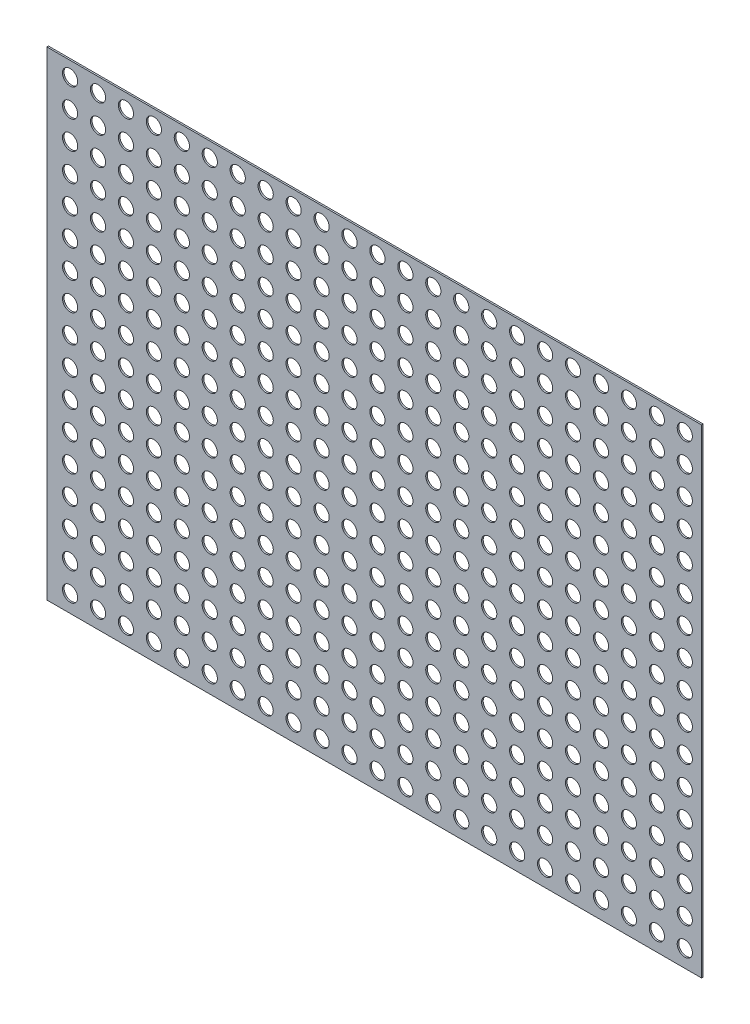
from build123d import *

# Parameters (mm, degrees)
SKETCH1_W           = 820
SKETCH1_H           = 600
BOSS_EXTRUDE1_DEPTH = 2
SKETCH2_R           = 9.524283463
CUT_EXTRUDE2_DEPTH  = 2
LPATTERN1_OUTLINE_R = 9.524283463
LPATTERN1_DEPTH     = 2


# Read off the part's stored shape, not the designer's step: LPattern1
with BuildPart() as part:
    # Sketch1 → Boss-Extrude1 (new body)
    with BuildSketch(Plane.XY):
        Rectangle(SKETCH1_W, SKETCH1_H)
    extrude(amount=BOSS_EXTRUDE1_DEPTH)

    # Sketch2 → Cut-Extrude2 (cut)
    with BuildSketch(Plane.XY):
        with Locations((-380.950405278, 281.61650156)):
            Circle(SKETCH2_R)
    extrude(amount=CUT_EXTRUDE2_DEPTH, mode=Mode.SUBTRACT)

    # LPattern1 outline → LPattern1 (cut)
    with BuildSketch(Plane.XY):
        with Locations((389.049594722, -278.38349844)):
            Circle(LPATTERN1_OUTLINE_R)
        with Locations((354.049594722, -278.38349844)):
            Circle(LPATTERN1_OUTLINE_R)
        with Locations((319.049594722, -278.38349844)):
            Circle(LPATTERN1_OUTLINE_R)
        with Locations((284.049594722, -278.38349844)):
            Circle(LPATTERN1_OUTLINE_R)
        with Locations((249.049594722, -278.38349844)):
            Circle(LPATTERN1_OUTLINE_R)
        with Locations((214.049594722, -278.38349844)):
            Circle(LPATTERN1_OUTLINE_R)
        with Locations((179.049594722, -278.38349844)):
            Circle(LPATTERN1_OUTLINE_R)
        with Locations((144.049594722, -278.38349844)):
            Circle(LPATTERN1_OUTLINE_R)
        with Locations((109.049594722, -278.38349844)):
            Circle(LPATTERN1_OUTLINE_R)
        with Locations((74.049594722, -278.38349844)):
            Circle(LPATTERN1_OUTLINE_R)
        with Locations((39.049594722, -278.38349844)):
            Circle(LPATTERN1_OUTLINE_R)
        with Locations((4.049594722, -278.38349844)):
            Circle(LPATTERN1_OUTLINE_R)
        with Locations((-30.950405278, -278.38349844)):
            Circle(LPATTERN1_OUTLINE_R)
        with Locations((-65.950405278, -278.38349844)):
            Circle(LPATTERN1_OUTLINE_R)
        with Locations((-100.950405278, -278.38349844)):
            Circle(LPATTERN1_OUTLINE_R)
        with Locations((-135.950405278, -278.38349844)):
            Circle(LPATTERN1_OUTLINE_R)
        with Locations((-170.950405278, -278.38349844)):
            Circle(LPATTERN1_OUTLINE_R)
        with Locations((-205.950405278, -278.38349844)):
            Circle(LPATTERN1_OUTLINE_R)
        with Locations((-240.950405278, -278.38349844)):
            Circle(LPATTERN1_OUTLINE_R)
        with Locations((-275.950405278, -278.38349844)):
            Circle(LPATTERN1_OUTLINE_R)
        with Locations((-310.950405278, -278.38349844)):
            Circle(LPATTERN1_OUTLINE_R)
        with Locations((-345.950405278, -278.38349844)):
            Circle(LPATTERN1_OUTLINE_R)
        with Locations((-380.950405278, -278.38349844)):
            Circle(LPATTERN1_OUTLINE_R)
        with Locations((389.049594722, -243.38349844)):
            Circle(LPATTERN1_OUTLINE_R)
        with Locations((354.049594722, -243.38349844)):
            Circle(LPATTERN1_OUTLINE_R)
        with Locations((319.049594722, -243.38349844)):
            Circle(LPATTERN1_OUTLINE_R)
        with Locations((284.049594722, -243.38349844)):
            Circle(LPATTERN1_OUTLINE_R)
        with Locations((249.049594722, -243.38349844)):
            Circle(LPATTERN1_OUTLINE_R)
        with Locations((214.049594722, -243.38349844)):
            Circle(LPATTERN1_OUTLINE_R)
        with Locations((179.049594722, -243.38349844)):
            Circle(LPATTERN1_OUTLINE_R)
        with Locations((144.049594722, -243.38349844)):
            Circle(LPATTERN1_OUTLINE_R)
        with Locations((109.049594722, -243.38349844)):
            Circle(LPATTERN1_OUTLINE_R)
        with Locations((74.049594722, -243.38349844)):
            Circle(LPATTERN1_OUTLINE_R)
        with Locations((39.049594722, -243.38349844)):
            Circle(LPATTERN1_OUTLINE_R)
        with Locations((4.049594722, -243.38349844)):
            Circle(LPATTERN1_OUTLINE_R)
        with Locations((-30.950405278, -243.38349844)):
            Circle(LPATTERN1_OUTLINE_R)
        with Locations((-65.950405278, -243.38349844)):
            Circle(LPATTERN1_OUTLINE_R)
        with Locations((-100.950405278, -243.38349844)):
            Circle(LPATTERN1_OUTLINE_R)
        with Locations((-135.950405278, -243.38349844)):
            Circle(LPATTERN1_OUTLINE_R)
        with Locations((-170.950405278, -243.38349844)):
            Circle(LPATTERN1_OUTLINE_R)
        with Locations((-205.950405278, -243.38349844)):
            Circle(LPATTERN1_OUTLINE_R)
        with Locations((-240.950405278, -243.38349844)):
            Circle(LPATTERN1_OUTLINE_R)
        with Locations((-275.950405278, -243.38349844)):
            Circle(LPATTERN1_OUTLINE_R)
        with Locations((-310.950405278, -243.38349844)):
            Circle(LPATTERN1_OUTLINE_R)
        with Locations((-345.950405278, -243.38349844)):
            Circle(LPATTERN1_OUTLINE_R)
        with Locations((-380.950405278, -243.38349844)):
            Circle(LPATTERN1_OUTLINE_R)
        with Locations((389.049594722, -208.38349844)):
            Circle(LPATTERN1_OUTLINE_R)
        with Locations((354.049594722, -208.38349844)):
            Circle(LPATTERN1_OUTLINE_R)
        with Locations((319.049594722, -208.38349844)):
            Circle(LPATTERN1_OUTLINE_R)
        with Locations((284.049594722, -208.38349844)):
            Circle(LPATTERN1_OUTLINE_R)
        with Locations((249.049594722, -208.38349844)):
            Circle(LPATTERN1_OUTLINE_R)
        with Locations((214.049594722, -208.38349844)):
            Circle(LPATTERN1_OUTLINE_R)
        with Locations((179.049594722, -208.38349844)):
            Circle(LPATTERN1_OUTLINE_R)
        with Locations((144.049594722, -208.38349844)):
            Circle(LPATTERN1_OUTLINE_R)
        with Locations((109.049594722, -208.38349844)):
            Circle(LPATTERN1_OUTLINE_R)
        with Locations((74.049594722, -208.38349844)):
            Circle(LPATTERN1_OUTLINE_R)
        with Locations((39.049594722, -208.38349844)):
            Circle(LPATTERN1_OUTLINE_R)
        with Locations((4.049594722, -208.38349844)):
            Circle(LPATTERN1_OUTLINE_R)
        with Locations((-30.950405278, -208.38349844)):
            Circle(LPATTERN1_OUTLINE_R)
        with Locations((-65.950405278, -208.38349844)):
            Circle(LPATTERN1_OUTLINE_R)
        with Locations((-100.950405278, -208.38349844)):
            Circle(LPATTERN1_OUTLINE_R)
        with Locations((-135.950405278, -208.38349844)):
            Circle(LPATTERN1_OUTLINE_R)
        with Locations((-170.950405278, -208.38349844)):
            Circle(LPATTERN1_OUTLINE_R)
        with Locations((-205.950405278, -208.38349844)):
            Circle(LPATTERN1_OUTLINE_R)
        with Locations((-240.950405278, -208.38349844)):
            Circle(LPATTERN1_OUTLINE_R)
        with Locations((-275.950405278, -208.38349844)):
            Circle(LPATTERN1_OUTLINE_R)
        with Locations((-310.950405278, -208.38349844)):
            Circle(LPATTERN1_OUTLINE_R)
        with Locations((-345.950405278, -208.38349844)):
            Circle(LPATTERN1_OUTLINE_R)
        with Locations((-380.950405278, -208.38349844)):
            Circle(LPATTERN1_OUTLINE_R)
        with Locations((389.049594722, -173.38349844)):
            Circle(LPATTERN1_OUTLINE_R)
        with Locations((354.049594722, -173.38349844)):
            Circle(LPATTERN1_OUTLINE_R)
        with Locations((319.049594722, -173.38349844)):
            Circle(LPATTERN1_OUTLINE_R)
        with Locations((284.049594722, -173.38349844)):
            Circle(LPATTERN1_OUTLINE_R)
        with Locations((249.049594722, -173.38349844)):
            Circle(LPATTERN1_OUTLINE_R)
        with Locations((214.049594722, -173.38349844)):
            Circle(LPATTERN1_OUTLINE_R)
        with Locations((179.049594722, -173.38349844)):
            Circle(LPATTERN1_OUTLINE_R)
        with Locations((144.049594722, -173.38349844)):
            Circle(LPATTERN1_OUTLINE_R)
        with Locations((109.049594722, -173.38349844)):
            Circle(LPATTERN1_OUTLINE_R)
        with Locations((74.049594722, -173.38349844)):
            Circle(LPATTERN1_OUTLINE_R)
        with Locations((39.049594722, -173.38349844)):
            Circle(LPATTERN1_OUTLINE_R)
        with Locations((4.049594722, -173.38349844)):
            Circle(LPATTERN1_OUTLINE_R)
        with Locations((-30.950405278, -173.38349844)):
            Circle(LPATTERN1_OUTLINE_R)
        with Locations((-65.950405278, -173.38349844)):
            Circle(LPATTERN1_OUTLINE_R)
        with Locations((-100.950405278, -173.38349844)):
            Circle(LPATTERN1_OUTLINE_R)
        with Locations((-135.950405278, -173.38349844)):
            Circle(LPATTERN1_OUTLINE_R)
        with Locations((-170.950405278, -173.38349844)):
            Circle(LPATTERN1_OUTLINE_R)
        with Locations((-205.950405278, -173.38349844)):
            Circle(LPATTERN1_OUTLINE_R)
        with Locations((-240.950405278, -173.38349844)):
            Circle(LPATTERN1_OUTLINE_R)
        with Locations((-275.950405278, -173.38349844)):
            Circle(LPATTERN1_OUTLINE_R)
        with Locations((-310.950405278, -173.38349844)):
            Circle(LPATTERN1_OUTLINE_R)
        with Locations((-345.950405278, -173.38349844)):
            Circle(LPATTERN1_OUTLINE_R)
        with Locations((-380.950405278, -173.38349844)):
            Circle(LPATTERN1_OUTLINE_R)
        with Locations((389.049594722, -138.38349844)):
            Circle(LPATTERN1_OUTLINE_R)
        with Locations((354.049594722, -138.38349844)):
            Circle(LPATTERN1_OUTLINE_R)
        with Locations((319.049594722, -138.38349844)):
            Circle(LPATTERN1_OUTLINE_R)
        with Locations((284.049594722, -138.38349844)):
            Circle(LPATTERN1_OUTLINE_R)
        with Locations((249.049594722, -138.38349844)):
            Circle(LPATTERN1_OUTLINE_R)
        with Locations((214.049594722, -138.38349844)):
            Circle(LPATTERN1_OUTLINE_R)
        with Locations((179.049594722, -138.38349844)):
            Circle(LPATTERN1_OUTLINE_R)
        with Locations((144.049594722, -138.38349844)):
            Circle(LPATTERN1_OUTLINE_R)
        with Locations((109.049594722, -138.38349844)):
            Circle(LPATTERN1_OUTLINE_R)
        with Locations((74.049594722, -138.38349844)):
            Circle(LPATTERN1_OUTLINE_R)
        with Locations((39.049594722, -138.38349844)):
            Circle(LPATTERN1_OUTLINE_R)
        with Locations((4.049594722, -138.38349844)):
            Circle(LPATTERN1_OUTLINE_R)
        with Locations((-30.950405278, -138.38349844)):
            Circle(LPATTERN1_OUTLINE_R)
        with Locations((-65.950405278, -138.38349844)):
            Circle(LPATTERN1_OUTLINE_R)
        with Locations((-100.950405278, -138.38349844)):
            Circle(LPATTERN1_OUTLINE_R)
        with Locations((-135.950405278, -138.38349844)):
            Circle(LPATTERN1_OUTLINE_R)
        with Locations((-170.950405278, -138.38349844)):
            Circle(LPATTERN1_OUTLINE_R)
        with Locations((-205.950405278, -138.38349844)):
            Circle(LPATTERN1_OUTLINE_R)
        with Locations((-240.950405278, -138.38349844)):
            Circle(LPATTERN1_OUTLINE_R)
        with Locations((-275.950405278, -138.38349844)):
            Circle(LPATTERN1_OUTLINE_R)
        with Locations((-310.950405278, -138.38349844)):
            Circle(LPATTERN1_OUTLINE_R)
        with Locations((-345.950405278, -138.38349844)):
            Circle(LPATTERN1_OUTLINE_R)
        with Locations((-380.950405278, -138.38349844)):
            Circle(LPATTERN1_OUTLINE_R)
        with Locations((389.049594722, -103.38349844)):
            Circle(LPATTERN1_OUTLINE_R)
        with Locations((354.049594722, -103.38349844)):
            Circle(LPATTERN1_OUTLINE_R)
        with Locations((319.049594722, -103.38349844)):
            Circle(LPATTERN1_OUTLINE_R)
        with Locations((284.049594722, -103.38349844)):
            Circle(LPATTERN1_OUTLINE_R)
        with Locations((249.049594722, -103.38349844)):
            Circle(LPATTERN1_OUTLINE_R)
        with Locations((214.049594722, -103.38349844)):
            Circle(LPATTERN1_OUTLINE_R)
        with Locations((179.049594722, -103.38349844)):
            Circle(LPATTERN1_OUTLINE_R)
        with Locations((144.049594722, -103.38349844)):
            Circle(LPATTERN1_OUTLINE_R)
        with Locations((109.049594722, -103.38349844)):
            Circle(LPATTERN1_OUTLINE_R)
        with Locations((74.049594722, -103.38349844)):
            Circle(LPATTERN1_OUTLINE_R)
        with Locations((39.049594722, -103.38349844)):
            Circle(LPATTERN1_OUTLINE_R)
        with Locations((4.049594722, -103.38349844)):
            Circle(LPATTERN1_OUTLINE_R)
        with Locations((-30.950405278, -103.38349844)):
            Circle(LPATTERN1_OUTLINE_R)
        with Locations((-65.950405278, -103.38349844)):
            Circle(LPATTERN1_OUTLINE_R)
        with Locations((-100.950405278, -103.38349844)):
            Circle(LPATTERN1_OUTLINE_R)
        with Locations((-135.950405278, -103.38349844)):
            Circle(LPATTERN1_OUTLINE_R)
        with Locations((-170.950405278, -103.38349844)):
            Circle(LPATTERN1_OUTLINE_R)
        with Locations((-205.950405278, -103.38349844)):
            Circle(LPATTERN1_OUTLINE_R)
        with Locations((-240.950405278, -103.38349844)):
            Circle(LPATTERN1_OUTLINE_R)
        with Locations((-275.950405278, -103.38349844)):
            Circle(LPATTERN1_OUTLINE_R)
        with Locations((-310.950405278, -103.38349844)):
            Circle(LPATTERN1_OUTLINE_R)
        with Locations((-345.950405278, -103.38349844)):
            Circle(LPATTERN1_OUTLINE_R)
        with Locations((-380.950405278, -103.38349844)):
            Circle(LPATTERN1_OUTLINE_R)
        with Locations((389.049594722, -68.38349844)):
            Circle(LPATTERN1_OUTLINE_R)
        with Locations((354.049594722, -68.38349844)):
            Circle(LPATTERN1_OUTLINE_R)
        with Locations((319.049594722, -68.38349844)):
            Circle(LPATTERN1_OUTLINE_R)
        with Locations((284.049594722, -68.38349844)):
            Circle(LPATTERN1_OUTLINE_R)
        with Locations((249.049594722, -68.38349844)):
            Circle(LPATTERN1_OUTLINE_R)
        with Locations((214.049594722, -68.38349844)):
            Circle(LPATTERN1_OUTLINE_R)
        with Locations((179.049594722, -68.38349844)):
            Circle(LPATTERN1_OUTLINE_R)
        with Locations((144.049594722, -68.38349844)):
            Circle(LPATTERN1_OUTLINE_R)
        with Locations((109.049594722, -68.38349844)):
            Circle(LPATTERN1_OUTLINE_R)
        with Locations((74.049594722, -68.38349844)):
            Circle(LPATTERN1_OUTLINE_R)
        with Locations((39.049594722, -68.38349844)):
            Circle(LPATTERN1_OUTLINE_R)
        with Locations((4.049594722, -68.38349844)):
            Circle(LPATTERN1_OUTLINE_R)
        with Locations((-30.950405278, -68.38349844)):
            Circle(LPATTERN1_OUTLINE_R)
        with Locations((-65.950405278, -68.38349844)):
            Circle(LPATTERN1_OUTLINE_R)
        with Locations((-100.950405278, -68.38349844)):
            Circle(LPATTERN1_OUTLINE_R)
        with Locations((-135.950405278, -68.38349844)):
            Circle(LPATTERN1_OUTLINE_R)
        with Locations((-170.950405278, -68.38349844)):
            Circle(LPATTERN1_OUTLINE_R)
        with Locations((-205.950405278, -68.38349844)):
            Circle(LPATTERN1_OUTLINE_R)
        with Locations((-240.950405278, -68.38349844)):
            Circle(LPATTERN1_OUTLINE_R)
        with Locations((-275.950405278, -68.38349844)):
            Circle(LPATTERN1_OUTLINE_R)
        with Locations((-310.950405278, -68.38349844)):
            Circle(LPATTERN1_OUTLINE_R)
        with Locations((-345.950405278, -68.38349844)):
            Circle(LPATTERN1_OUTLINE_R)
        with Locations((-380.950405278, -68.38349844)):
            Circle(LPATTERN1_OUTLINE_R)
        with Locations((389.049594722, -33.38349844)):
            Circle(LPATTERN1_OUTLINE_R)
        with Locations((354.049594722, -33.38349844)):
            Circle(LPATTERN1_OUTLINE_R)
        with Locations((319.049594722, -33.38349844)):
            Circle(LPATTERN1_OUTLINE_R)
        with Locations((284.049594722, -33.38349844)):
            Circle(LPATTERN1_OUTLINE_R)
        with Locations((249.049594722, -33.38349844)):
            Circle(LPATTERN1_OUTLINE_R)
        with Locations((214.049594722, -33.38349844)):
            Circle(LPATTERN1_OUTLINE_R)
        with Locations((179.049594722, -33.38349844)):
            Circle(LPATTERN1_OUTLINE_R)
        with Locations((144.049594722, -33.38349844)):
            Circle(LPATTERN1_OUTLINE_R)
        with Locations((109.049594722, -33.38349844)):
            Circle(LPATTERN1_OUTLINE_R)
        with Locations((74.049594722, -33.38349844)):
            Circle(LPATTERN1_OUTLINE_R)
        with Locations((39.049594722, -33.38349844)):
            Circle(LPATTERN1_OUTLINE_R)
        with Locations((4.049594722, -33.38349844)):
            Circle(LPATTERN1_OUTLINE_R)
        with Locations((-30.950405278, -33.38349844)):
            Circle(LPATTERN1_OUTLINE_R)
        with Locations((-65.950405278, -33.38349844)):
            Circle(LPATTERN1_OUTLINE_R)
        with Locations((-100.950405278, -33.38349844)):
            Circle(LPATTERN1_OUTLINE_R)
        with Locations((-135.950405278, -33.38349844)):
            Circle(LPATTERN1_OUTLINE_R)
        with Locations((-170.950405278, -33.38349844)):
            Circle(LPATTERN1_OUTLINE_R)
        with Locations((-205.950405278, -33.38349844)):
            Circle(LPATTERN1_OUTLINE_R)
        with Locations((-240.950405278, -33.38349844)):
            Circle(LPATTERN1_OUTLINE_R)
        with Locations((-275.950405278, -33.38349844)):
            Circle(LPATTERN1_OUTLINE_R)
        with Locations((-310.950405278, -33.38349844)):
            Circle(LPATTERN1_OUTLINE_R)
        with Locations((-345.950405278, -33.38349844)):
            Circle(LPATTERN1_OUTLINE_R)
        with Locations((-380.950405278, -33.38349844)):
            Circle(LPATTERN1_OUTLINE_R)
        with Locations((389.049594722, 1.61650156)):
            Circle(LPATTERN1_OUTLINE_R)
        with Locations((354.049594722, 1.61650156)):
            Circle(LPATTERN1_OUTLINE_R)
        with Locations((319.049594722, 1.61650156)):
            Circle(LPATTERN1_OUTLINE_R)
        with Locations((284.049594722, 1.61650156)):
            Circle(LPATTERN1_OUTLINE_R)
        with Locations((249.049594722, 1.61650156)):
            Circle(LPATTERN1_OUTLINE_R)
        with Locations((214.049594722, 1.61650156)):
            Circle(LPATTERN1_OUTLINE_R)
        with Locations((179.049594722, 1.61650156)):
            Circle(LPATTERN1_OUTLINE_R)
        with Locations((144.049594722, 1.61650156)):
            Circle(LPATTERN1_OUTLINE_R)
        with Locations((109.049594722, 1.61650156)):
            Circle(LPATTERN1_OUTLINE_R)
        with Locations((74.049594722, 1.61650156)):
            Circle(LPATTERN1_OUTLINE_R)
        with Locations((39.049594722, 1.61650156)):
            Circle(LPATTERN1_OUTLINE_R)
        with Locations((4.049594722, 1.61650156)):
            Circle(LPATTERN1_OUTLINE_R)
        with Locations((-30.950405278, 1.61650156)):
            Circle(LPATTERN1_OUTLINE_R)
        with Locations((-65.950405278, 1.61650156)):
            Circle(LPATTERN1_OUTLINE_R)
        with Locations((-100.950405278, 1.61650156)):
            Circle(LPATTERN1_OUTLINE_R)
        with Locations((-135.950405278, 1.61650156)):
            Circle(LPATTERN1_OUTLINE_R)
        with Locations((-170.950405278, 1.61650156)):
            Circle(LPATTERN1_OUTLINE_R)
        with Locations((-205.950405278, 1.61650156)):
            Circle(LPATTERN1_OUTLINE_R)
        with Locations((-240.950405278, 1.61650156)):
            Circle(LPATTERN1_OUTLINE_R)
        with Locations((-275.950405278, 1.61650156)):
            Circle(LPATTERN1_OUTLINE_R)
        with Locations((-310.950405278, 1.61650156)):
            Circle(LPATTERN1_OUTLINE_R)
        with Locations((-345.950405278, 1.61650156)):
            Circle(LPATTERN1_OUTLINE_R)
        with Locations((-380.950405278, 1.61650156)):
            Circle(LPATTERN1_OUTLINE_R)
        with Locations((389.049594722, 36.61650156)):
            Circle(LPATTERN1_OUTLINE_R)
        with Locations((354.049594722, 36.61650156)):
            Circle(LPATTERN1_OUTLINE_R)
        with Locations((319.049594722, 36.61650156)):
            Circle(LPATTERN1_OUTLINE_R)
        with Locations((284.049594722, 36.61650156)):
            Circle(LPATTERN1_OUTLINE_R)
        with Locations((249.049594722, 36.61650156)):
            Circle(LPATTERN1_OUTLINE_R)
        with Locations((214.049594722, 36.61650156)):
            Circle(LPATTERN1_OUTLINE_R)
        with Locations((179.049594722, 36.61650156)):
            Circle(LPATTERN1_OUTLINE_R)
        with Locations((144.049594722, 36.61650156)):
            Circle(LPATTERN1_OUTLINE_R)
        with Locations((109.049594722, 36.61650156)):
            Circle(LPATTERN1_OUTLINE_R)
        with Locations((74.049594722, 36.61650156)):
            Circle(LPATTERN1_OUTLINE_R)
        with Locations((39.049594722, 36.61650156)):
            Circle(LPATTERN1_OUTLINE_R)
        with Locations((4.049594722, 36.61650156)):
            Circle(LPATTERN1_OUTLINE_R)
        with Locations((-30.950405278, 36.61650156)):
            Circle(LPATTERN1_OUTLINE_R)
        with Locations((-65.950405278, 36.61650156)):
            Circle(LPATTERN1_OUTLINE_R)
        with Locations((-100.950405278, 36.61650156)):
            Circle(LPATTERN1_OUTLINE_R)
        with Locations((-135.950405278, 36.61650156)):
            Circle(LPATTERN1_OUTLINE_R)
        with Locations((-170.950405278, 36.61650156)):
            Circle(LPATTERN1_OUTLINE_R)
        with Locations((-205.950405278, 36.61650156)):
            Circle(LPATTERN1_OUTLINE_R)
        with Locations((-240.950405278, 36.61650156)):
            Circle(LPATTERN1_OUTLINE_R)
        with Locations((-275.950405278, 36.61650156)):
            Circle(LPATTERN1_OUTLINE_R)
        with Locations((-310.950405278, 36.61650156)):
            Circle(LPATTERN1_OUTLINE_R)
        with Locations((-345.950405278, 36.61650156)):
            Circle(LPATTERN1_OUTLINE_R)
        with Locations((-380.950405278, 36.61650156)):
            Circle(LPATTERN1_OUTLINE_R)
        with Locations((389.049594722, 71.61650156)):
            Circle(LPATTERN1_OUTLINE_R)
        with Locations((354.049594722, 71.61650156)):
            Circle(LPATTERN1_OUTLINE_R)
        with Locations((319.049594722, 71.61650156)):
            Circle(LPATTERN1_OUTLINE_R)
        with Locations((284.049594722, 71.61650156)):
            Circle(LPATTERN1_OUTLINE_R)
        with Locations((249.049594722, 71.61650156)):
            Circle(LPATTERN1_OUTLINE_R)
        with Locations((214.049594722, 71.61650156)):
            Circle(LPATTERN1_OUTLINE_R)
        with Locations((179.049594722, 71.61650156)):
            Circle(LPATTERN1_OUTLINE_R)
        with Locations((144.049594722, 71.61650156)):
            Circle(LPATTERN1_OUTLINE_R)
        with Locations((109.049594722, 71.61650156)):
            Circle(LPATTERN1_OUTLINE_R)
        with Locations((74.049594722, 71.61650156)):
            Circle(LPATTERN1_OUTLINE_R)
        with Locations((39.049594722, 71.61650156)):
            Circle(LPATTERN1_OUTLINE_R)
        with Locations((4.049594722, 71.61650156)):
            Circle(LPATTERN1_OUTLINE_R)
        with Locations((-30.950405278, 71.61650156)):
            Circle(LPATTERN1_OUTLINE_R)
        with Locations((-65.950405278, 71.61650156)):
            Circle(LPATTERN1_OUTLINE_R)
        with Locations((-100.950405278, 71.61650156)):
            Circle(LPATTERN1_OUTLINE_R)
        with Locations((-135.950405278, 71.61650156)):
            Circle(LPATTERN1_OUTLINE_R)
        with Locations((-170.950405278, 71.61650156)):
            Circle(LPATTERN1_OUTLINE_R)
        with Locations((-205.950405278, 71.61650156)):
            Circle(LPATTERN1_OUTLINE_R)
        with Locations((-240.950405278, 71.61650156)):
            Circle(LPATTERN1_OUTLINE_R)
        with Locations((-275.950405278, 71.61650156)):
            Circle(LPATTERN1_OUTLINE_R)
        with Locations((-310.950405278, 71.61650156)):
            Circle(LPATTERN1_OUTLINE_R)
        with Locations((-345.950405278, 71.61650156)):
            Circle(LPATTERN1_OUTLINE_R)
        with Locations((-380.950405278, 71.61650156)):
            Circle(LPATTERN1_OUTLINE_R)
        with Locations((389.049594722, 106.61650156)):
            Circle(LPATTERN1_OUTLINE_R)
        with Locations((354.049594722, 106.61650156)):
            Circle(LPATTERN1_OUTLINE_R)
        with Locations((319.049594722, 106.61650156)):
            Circle(LPATTERN1_OUTLINE_R)
        with Locations((284.049594722, 106.61650156)):
            Circle(LPATTERN1_OUTLINE_R)
        with Locations((249.049594722, 106.61650156)):
            Circle(LPATTERN1_OUTLINE_R)
        with Locations((214.049594722, 106.61650156)):
            Circle(LPATTERN1_OUTLINE_R)
        with Locations((179.049594722, 106.61650156)):
            Circle(LPATTERN1_OUTLINE_R)
        with Locations((144.049594722, 106.61650156)):
            Circle(LPATTERN1_OUTLINE_R)
        with Locations((109.049594722, 106.61650156)):
            Circle(LPATTERN1_OUTLINE_R)
        with Locations((74.049594722, 106.61650156)):
            Circle(LPATTERN1_OUTLINE_R)
        with Locations((39.049594722, 106.61650156)):
            Circle(LPATTERN1_OUTLINE_R)
        with Locations((4.049594722, 106.61650156)):
            Circle(LPATTERN1_OUTLINE_R)
        with Locations((-30.950405278, 106.61650156)):
            Circle(LPATTERN1_OUTLINE_R)
        with Locations((-65.950405278, 106.61650156)):
            Circle(LPATTERN1_OUTLINE_R)
        with Locations((-100.950405278, 106.61650156)):
            Circle(LPATTERN1_OUTLINE_R)
        with Locations((-135.950405278, 106.61650156)):
            Circle(LPATTERN1_OUTLINE_R)
        with Locations((-170.950405278, 106.61650156)):
            Circle(LPATTERN1_OUTLINE_R)
        with Locations((-205.950405278, 106.61650156)):
            Circle(LPATTERN1_OUTLINE_R)
        with Locations((-240.950405278, 106.61650156)):
            Circle(LPATTERN1_OUTLINE_R)
        with Locations((-275.950405278, 106.61650156)):
            Circle(LPATTERN1_OUTLINE_R)
        with Locations((-310.950405278, 106.61650156)):
            Circle(LPATTERN1_OUTLINE_R)
        with Locations((-345.950405278, 106.61650156)):
            Circle(LPATTERN1_OUTLINE_R)
        with Locations((-380.950405278, 106.61650156)):
            Circle(LPATTERN1_OUTLINE_R)
        with Locations((389.049594722, 141.61650156)):
            Circle(LPATTERN1_OUTLINE_R)
        with Locations((354.049594722, 141.61650156)):
            Circle(LPATTERN1_OUTLINE_R)
        with Locations((319.049594722, 141.61650156)):
            Circle(LPATTERN1_OUTLINE_R)
        with Locations((284.049594722, 141.61650156)):
            Circle(LPATTERN1_OUTLINE_R)
        with Locations((249.049594722, 141.61650156)):
            Circle(LPATTERN1_OUTLINE_R)
        with Locations((214.049594722, 141.61650156)):
            Circle(LPATTERN1_OUTLINE_R)
        with Locations((179.049594722, 141.61650156)):
            Circle(LPATTERN1_OUTLINE_R)
        with Locations((144.049594722, 141.61650156)):
            Circle(LPATTERN1_OUTLINE_R)
        with Locations((109.049594722, 141.61650156)):
            Circle(LPATTERN1_OUTLINE_R)
        with Locations((74.049594722, 141.61650156)):
            Circle(LPATTERN1_OUTLINE_R)
        with Locations((39.049594722, 141.61650156)):
            Circle(LPATTERN1_OUTLINE_R)
        with Locations((4.049594722, 141.61650156)):
            Circle(LPATTERN1_OUTLINE_R)
        with Locations((-30.950405278, 141.61650156)):
            Circle(LPATTERN1_OUTLINE_R)
        with Locations((-65.950405278, 141.61650156)):
            Circle(LPATTERN1_OUTLINE_R)
        with Locations((-100.950405278, 141.61650156)):
            Circle(LPATTERN1_OUTLINE_R)
        with Locations((-135.950405278, 141.61650156)):
            Circle(LPATTERN1_OUTLINE_R)
        with Locations((-170.950405278, 141.61650156)):
            Circle(LPATTERN1_OUTLINE_R)
        with Locations((-205.950405278, 141.61650156)):
            Circle(LPATTERN1_OUTLINE_R)
        with Locations((-240.950405278, 141.61650156)):
            Circle(LPATTERN1_OUTLINE_R)
        with Locations((-275.950405278, 141.61650156)):
            Circle(LPATTERN1_OUTLINE_R)
        with Locations((-310.950405278, 141.61650156)):
            Circle(LPATTERN1_OUTLINE_R)
        with Locations((-345.950405278, 141.61650156)):
            Circle(LPATTERN1_OUTLINE_R)
        with Locations((-380.950405278, 141.61650156)):
            Circle(LPATTERN1_OUTLINE_R)
        with Locations((389.049594722, 176.61650156)):
            Circle(LPATTERN1_OUTLINE_R)
        with Locations((354.049594722, 176.61650156)):
            Circle(LPATTERN1_OUTLINE_R)
        with Locations((319.049594722, 176.61650156)):
            Circle(LPATTERN1_OUTLINE_R)
        with Locations((284.049594722, 176.61650156)):
            Circle(LPATTERN1_OUTLINE_R)
        with Locations((249.049594722, 176.61650156)):
            Circle(LPATTERN1_OUTLINE_R)
        with Locations((214.049594722, 176.61650156)):
            Circle(LPATTERN1_OUTLINE_R)
        with Locations((179.049594722, 176.61650156)):
            Circle(LPATTERN1_OUTLINE_R)
        with Locations((144.049594722, 176.61650156)):
            Circle(LPATTERN1_OUTLINE_R)
        with Locations((109.049594722, 176.61650156)):
            Circle(LPATTERN1_OUTLINE_R)
        with Locations((74.049594722, 176.61650156)):
            Circle(LPATTERN1_OUTLINE_R)
        with Locations((39.049594722, 176.61650156)):
            Circle(LPATTERN1_OUTLINE_R)
        with Locations((4.049594722, 176.61650156)):
            Circle(LPATTERN1_OUTLINE_R)
        with Locations((-30.950405278, 176.61650156)):
            Circle(LPATTERN1_OUTLINE_R)
        with Locations((-65.950405278, 176.61650156)):
            Circle(LPATTERN1_OUTLINE_R)
        with Locations((-100.950405278, 176.61650156)):
            Circle(LPATTERN1_OUTLINE_R)
        with Locations((-135.950405278, 176.61650156)):
            Circle(LPATTERN1_OUTLINE_R)
        with Locations((-170.950405278, 176.61650156)):
            Circle(LPATTERN1_OUTLINE_R)
        with Locations((-205.950405278, 176.61650156)):
            Circle(LPATTERN1_OUTLINE_R)
        with Locations((-240.950405278, 176.61650156)):
            Circle(LPATTERN1_OUTLINE_R)
        with Locations((-275.950405278, 176.61650156)):
            Circle(LPATTERN1_OUTLINE_R)
        with Locations((-310.950405278, 176.61650156)):
            Circle(LPATTERN1_OUTLINE_R)
        with Locations((-345.950405278, 176.61650156)):
            Circle(LPATTERN1_OUTLINE_R)
        with Locations((-380.950405278, 176.61650156)):
            Circle(LPATTERN1_OUTLINE_R)
        with Locations((389.049594722, 211.61650156)):
            Circle(LPATTERN1_OUTLINE_R)
        with Locations((354.049594722, 211.61650156)):
            Circle(LPATTERN1_OUTLINE_R)
        with Locations((319.049594722, 211.61650156)):
            Circle(LPATTERN1_OUTLINE_R)
        with Locations((284.049594722, 211.61650156)):
            Circle(LPATTERN1_OUTLINE_R)
        with Locations((249.049594722, 211.61650156)):
            Circle(LPATTERN1_OUTLINE_R)
        with Locations((214.049594722, 211.61650156)):
            Circle(LPATTERN1_OUTLINE_R)
        with Locations((179.049594722, 211.61650156)):
            Circle(LPATTERN1_OUTLINE_R)
        with Locations((144.049594722, 211.61650156)):
            Circle(LPATTERN1_OUTLINE_R)
        with Locations((109.049594722, 211.61650156)):
            Circle(LPATTERN1_OUTLINE_R)
        with Locations((74.049594722, 211.61650156)):
            Circle(LPATTERN1_OUTLINE_R)
        with Locations((39.049594722, 211.61650156)):
            Circle(LPATTERN1_OUTLINE_R)
        with Locations((4.049594722, 211.61650156)):
            Circle(LPATTERN1_OUTLINE_R)
        with Locations((-30.950405278, 211.61650156)):
            Circle(LPATTERN1_OUTLINE_R)
        with Locations((-65.950405278, 211.61650156)):
            Circle(LPATTERN1_OUTLINE_R)
        with Locations((-100.950405278, 211.61650156)):
            Circle(LPATTERN1_OUTLINE_R)
        with Locations((-135.950405278, 211.61650156)):
            Circle(LPATTERN1_OUTLINE_R)
        with Locations((-170.950405278, 211.61650156)):
            Circle(LPATTERN1_OUTLINE_R)
        with Locations((-205.950405278, 211.61650156)):
            Circle(LPATTERN1_OUTLINE_R)
        with Locations((-240.950405278, 211.61650156)):
            Circle(LPATTERN1_OUTLINE_R)
        with Locations((-275.950405278, 211.61650156)):
            Circle(LPATTERN1_OUTLINE_R)
        with Locations((-310.950405278, 211.61650156)):
            Circle(LPATTERN1_OUTLINE_R)
        with Locations((-345.950405278, 211.61650156)):
            Circle(LPATTERN1_OUTLINE_R)
        with Locations((-380.950405278, 211.61650156)):
            Circle(LPATTERN1_OUTLINE_R)
        with Locations((389.049594722, 246.61650156)):
            Circle(LPATTERN1_OUTLINE_R)
        with Locations((354.049594722, 246.61650156)):
            Circle(LPATTERN1_OUTLINE_R)
        with Locations((319.049594722, 246.61650156)):
            Circle(LPATTERN1_OUTLINE_R)
        with Locations((284.049594722, 246.61650156)):
            Circle(LPATTERN1_OUTLINE_R)
        with Locations((249.049594722, 246.61650156)):
            Circle(LPATTERN1_OUTLINE_R)
        with Locations((214.049594722, 246.61650156)):
            Circle(LPATTERN1_OUTLINE_R)
        with Locations((179.049594722, 246.61650156)):
            Circle(LPATTERN1_OUTLINE_R)
        with Locations((144.049594722, 246.61650156)):
            Circle(LPATTERN1_OUTLINE_R)
        with Locations((109.049594722, 246.61650156)):
            Circle(LPATTERN1_OUTLINE_R)
        with Locations((74.049594722, 246.61650156)):
            Circle(LPATTERN1_OUTLINE_R)
        with Locations((39.049594722, 246.61650156)):
            Circle(LPATTERN1_OUTLINE_R)
        with Locations((4.049594722, 246.61650156)):
            Circle(LPATTERN1_OUTLINE_R)
        with Locations((-30.950405278, 246.61650156)):
            Circle(LPATTERN1_OUTLINE_R)
        with Locations((-65.950405278, 246.61650156)):
            Circle(LPATTERN1_OUTLINE_R)
        with Locations((-100.950405278, 246.61650156)):
            Circle(LPATTERN1_OUTLINE_R)
        with Locations((-135.950405278, 246.61650156)):
            Circle(LPATTERN1_OUTLINE_R)
        with Locations((-170.950405278, 246.61650156)):
            Circle(LPATTERN1_OUTLINE_R)
        with Locations((-205.950405278, 246.61650156)):
            Circle(LPATTERN1_OUTLINE_R)
        with Locations((-240.950405278, 246.61650156)):
            Circle(LPATTERN1_OUTLINE_R)
        with Locations((-275.950405278, 246.61650156)):
            Circle(LPATTERN1_OUTLINE_R)
        with Locations((-310.950405278, 246.61650156)):
            Circle(LPATTERN1_OUTLINE_R)
        with Locations((-345.950405278, 246.61650156)):
            Circle(LPATTERN1_OUTLINE_R)
        with Locations((-380.950405278, 246.61650156)):
            Circle(LPATTERN1_OUTLINE_R)
        with Locations((389.049594722, 281.61650156)):
            Circle(LPATTERN1_OUTLINE_R)
        with Locations((354.049594722, 281.61650156)):
            Circle(LPATTERN1_OUTLINE_R)
        with Locations((319.049594722, 281.61650156)):
            Circle(LPATTERN1_OUTLINE_R)
        with Locations((284.049594722, 281.61650156)):
            Circle(LPATTERN1_OUTLINE_R)
        with Locations((249.049594722, 281.61650156)):
            Circle(LPATTERN1_OUTLINE_R)
        with Locations((214.049594722, 281.61650156)):
            Circle(LPATTERN1_OUTLINE_R)
        with Locations((179.049594722, 281.61650156)):
            Circle(LPATTERN1_OUTLINE_R)
        with Locations((144.049594722, 281.61650156)):
            Circle(LPATTERN1_OUTLINE_R)
        with Locations((109.049594722, 281.61650156)):
            Circle(LPATTERN1_OUTLINE_R)
        with Locations((74.049594722, 281.61650156)):
            Circle(LPATTERN1_OUTLINE_R)
        with Locations((39.049594722, 281.61650156)):
            Circle(LPATTERN1_OUTLINE_R)
        with Locations((4.049594722, 281.61650156)):
            Circle(LPATTERN1_OUTLINE_R)
        with Locations((-30.950405278, 281.61650156)):
            Circle(LPATTERN1_OUTLINE_R)
        with Locations((-65.950405278, 281.61650156)):
            Circle(LPATTERN1_OUTLINE_R)
        with Locations((-100.950405278, 281.61650156)):
            Circle(LPATTERN1_OUTLINE_R)
        with Locations((-135.950405278, 281.61650156)):
            Circle(LPATTERN1_OUTLINE_R)
        with Locations((-170.950405278, 281.61650156)):
            Circle(LPATTERN1_OUTLINE_R)
        with Locations((-205.950405278, 281.61650156)):
            Circle(LPATTERN1_OUTLINE_R)
        with Locations((-240.950405278, 281.61650156)):
            Circle(LPATTERN1_OUTLINE_R)
        with Locations((-275.950405278, 281.61650156)):
            Circle(LPATTERN1_OUTLINE_R)
        with Locations((-310.950405278, 281.61650156)):
            Circle(LPATTERN1_OUTLINE_R)
        with Locations((-345.950405278, 281.61650156)):
            Circle(LPATTERN1_OUTLINE_R)
    extrude(amount=LPATTERN1_DEPTH, mode=Mode.SUBTRACT)


solid = part.part
